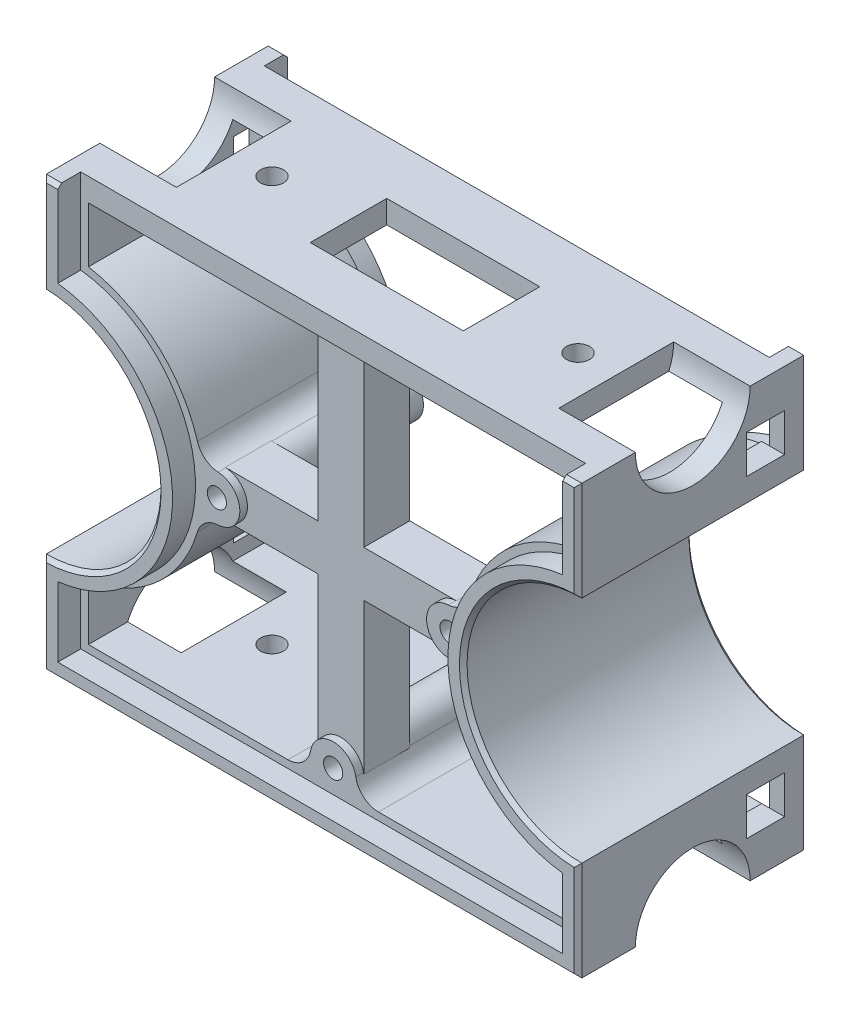
from build123d import *

# Parameters (mm, degrees)
SKETCH1_W                   = 70
SKETCH1_H                   = 30
BOSS_EXTRUDE1_DEPTH         = 56
CUT_EXTRUDE1_DEPTH          = 73.532751223
CUT_EXTRUDE2_DEPTH          = 68.720011813
CUT_EXTRUDE2_DEPTH_BACK     = 5
SKETCH3_R                   = 1.5
SKETCH4_R                   = 7.5
CUT_EXTRUDE5_DEPTH          = 10
SKETCH6_R                   = 15
CUT_EXTRUDE7_DEPTH          = 73.532751223
SKETCH7_W                   = 20
SKETCH7_H                   = 10
CUT_EXTRUDE8_DEPTH          = 10
CUT_EXTRUDE10_START         = -10
SKETCH8_R                   = 1.5
CUT_EXTRUDE10_DEPTH         = 10
CUT_EXTRUDE11_DEPTH         = 3
BOSS_EXTRUDE2_START         = -10
BOSS_EXTRUDE2_DEPTH         = 6
CHAMFER1_SIZE               = 0.5
CHAMFER2_SIZE               = 0.5
SKETCH10_W                  = 66
SKETCH10_H                  = 2
CUT_EXTRUDE13_DEPTH         = 3
CUT_EXTRUDE14_START         = -3
SKETCH12_W                  = 5
SKETCH12_H                  = 5
CUT_EXTRUDE14_DEPTH         = 3
BOSS_EXTRUDE3_START         = -24
BOSS_EXTRUDE3_DEPTH         = 24
TAP_DRILL_FOR_M3X0_5_TAP1_D = 2.5
FILLET1_R                   = 3


with BuildPart() as part:
    # Sketch1 → Boss-Extrude1 (new body)
    with BuildSketch(Plane(origin=(0, 0, 0), x_dir=(1, 0, 0), z_dir=(0, 1, 0))):
        Rectangle(SKETCH1_W, SKETCH1_H)
    extrude(amount=BOSS_EXTRUDE1_DEPTH)

    # Sketch2 → Cut-Extrude1 (cut, through all)
    with BuildSketch(Plane(origin=(0, 0, -15), x_dir=(-1, 0, 0), z_dir=(0, 0, -1))):
        with BuildLine():
            Line((32, 53), (-32, 53))
            Line((-32, 53), (-32, 45.748239349))
            ThreePointArc((-32, 45.748239349), (-17, 28), (-32, 10.251760651))
            Line((-32, 10.251760651), (-32, 3))
            Line((-32, 3), (32, 3))
            Line((32, 3), (32, 10.251760651))
            ThreePointArc((32, 10.251760651), (17, 28), (32, 45.748239349))
            Line((32, 45.748239349), (32, 53))
        make_face()
    extrude(amount=-CUT_EXTRUDE1_DEPTH, mode=Mode.SUBTRACT)

    # Sketch3 → Cut-Extrude2 (cut, two sides: drawn at the far end of the back side and taken through both)
    with BuildSketch(Plane.XZ.offset(-CUT_EXTRUDE2_DEPTH_BACK)):
        with Locations(Location((20, 0, 0), (0, 0, 90))):
            Circle(SKETCH3_R)
        with Locations(Location((-20, 0, 0), (0, 0, 90))):
            Circle(SKETCH3_R)
    extrude(amount=CUT_EXTRUDE2_DEPTH + CUT_EXTRUDE2_DEPTH_BACK, mode=Mode.SUBTRACT)

    # Sketch4 → Cut-Extrude5 (cut)
    with BuildSketch(Plane(origin=(35, 0, 0), x_dir=(0, 0, -1), z_dir=(1, 0, 0))):
        with Locations((0, 56)):
            Circle(SKETCH4_R)
        Circle(SKETCH4_R)
    cut_extrude5 = extrude(amount=-CUT_EXTRUDE5_DEPTH, mode=Mode.SUBTRACT)

    # Sketch6 → Cut-Extrude7 (cut, through all)
    with BuildSketch(Plane.XY.offset(15)):
        with Locations((-35, 28)):
            Circle(SKETCH6_R)
        with Locations((35, 28)):
            Circle(SKETCH6_R)
    extrude(amount=-CUT_EXTRUDE7_DEPTH, mode=Mode.SUBTRACT)

    # Sketch7 → Cut-Extrude8 (cut)
    with BuildSketch(Plane(origin=(0, 56, 0), x_dir=(1, 0, 0), z_dir=(0, 1, 0))):
        Rectangle(SKETCH7_W, SKETCH7_H)
    extrude(amount=-CUT_EXTRUDE8_DEPTH, mode=Mode.SUBTRACT)

    # Sketch8 → Cut-Extrude10 (cut)
    with BuildSketch(Plane(origin=(0, 56, 0), x_dir=(1, 0, 0), z_dir=(0, 1, 0)).offset(CUT_EXTRUDE10_START)):
        with Locations(Location((20, 0, 0), (0, 0, 270))):
            Circle(SKETCH8_R)
        with Locations(Location((-20, 0, 0), (0, 0, 270))):
            Circle(SKETCH8_R)
    extrude(amount=CUT_EXTRUDE10_DEPTH, mode=Mode.SUBTRACT)

    # Sketch2<3> → Cut-Extrude11 (cut)
    with BuildSketch(Plane(origin=(0, 0, -15), x_dir=(-1, 0, 0), z_dir=(0, 0, -1))):
        with BuildLine():
            Line((-33, 54), (-33, 44.881943016))
            ThreePointArc((-33, 44.881943016), (-18, 28), (-33, 11.118056984))
            Line((-33, 11.118056984), (-33, 2))
            Line((-33, 2), (33, 2))
            Line((33, 2), (33, 11.118056984))
            ThreePointArc((33, 11.118056984), (18, 28), (33, 44.881943016))
            Line((33, 44.881943016), (33, 54))
            Line((33, 54), (-33, 54))
        make_face()
        with BuildLine():
            Line((32, 53), (-32, 53))
            Line((-32, 53), (-32, 45.748239349))
            ThreePointArc((-32, 45.748239349), (-17, 28), (-32, 10.251760651))
            Line((-32, 10.251760651), (-32, 3))
            Line((-32, 3), (32, 3))
            Line((32, 3), (32, 10.251760651))
            ThreePointArc((32, 10.251760651), (17, 28), (32, 45.748239349))
            Line((32, 45.748239349), (32, 53))
        make_face(mode=Mode.SUBTRACT)
    cut_extrude11 = extrude(amount=-CUT_EXTRUDE11_DEPTH, mode=Mode.SUBTRACT)

    # Sketch11 → Boss-Extrude2 (add)
    with BuildSketch(Plane.XY.offset(15).offset(BOSS_EXTRUDE2_START)):
        with BuildLine():
            Line((-3, 3), (3, 3))
            Line((3, 3), (3, 25))
            Line((3, 25), (17.251760651, 25))
            ThreePointArc((17.251760651, 25), (17, 28), (17.251760651, 31))
            Line((17.251760651, 31), (3, 31))
            Line((3, 31), (3, 53))
            Line((3, 53), (-3, 53))
            Line((-3, 53), (-3, 31))
            Line((-3, 31), (-17.251760651, 31))
            ThreePointArc((-17.251760651, 31), (-17, 28), (-17.251760651, 25))
            Line((-17.251760651, 25), (-3, 25))
            Line((-3, 25), (-3, 3))
        make_face()
    extrude(amount=BOSS_EXTRUDE2_DEPTH)

    # Chamfer1
    chamfer1_edges = [part.edges().sort_by_distance(p)[0] for p in [
        (0, 56, 15),
        (32, 6.625880325, 15),
        (32, 49.374119675, 15),
        (0, 53, 15),
        (-32, 49.374119675, 15),
        (-17, 28, 15),
        (-32, 6.625880325, 15),
        (0, 3, 15),
        (17, 28, 15),
        (0, 0, 15),
        (35, 49.5, 15),
        (-35, 49.5, 15),
        (-35, 6.5, 15),
        (35, 6.5, 15),
        (-20, 28, 15),
        (20, 28, 15),
    ]]
    chamfer(chamfer1_edges, length=CHAMFER1_SIZE)

    # Chamfer2
    chamfer2_edges = [part.edges().sort_by_distance(p)[0] for p in [
        (0, 0, -15),
        (0, 56, -15),
        (-35, 49.5, -15),
        (35, 49.5, -15),
        (-35, 6.5, -15),
        (35, 6.5, -15),
        (-20, 28, -15),
        (20, 28, -15),
    ]]
    chamfer(chamfer2_edges, length=CHAMFER2_SIZE)

    # Sketch10 → Cut-Extrude13 (cut)
    with BuildSketch(Plane(origin=(0, 0, -15), x_dir=(-1, 0, 0), z_dir=(0, 0, -1))):
        with Locations((0, 55)):
            Rectangle(SKETCH10_W, SKETCH10_H)
    cut_extrude13 = extrude(amount=-CUT_EXTRUDE13_DEPTH, mode=Mode.SUBTRACT)

    # Mirror2: Cut-Extrude11, Cut-Extrude13 across plane
    add(cut_extrude11.mirror(Plane.XY), mode=Mode.SUBTRACT)
    add(cut_extrude13.mirror(Plane.XY), mode=Mode.SUBTRACT)

    # Sketch12 → Cut-Extrude14 (cut)
    with BuildSketch(Plane(origin=(35, 0, 0), x_dir=(0, 0, -1), z_dir=(1, 0, 0)).offset(CUT_EXTRUDE14_START)):
        with Locations((9.5, 7.5)):
            Rectangle(SKETCH12_W, SKETCH12_H)
        with Locations((9.5, 48.5)):
            Rectangle(SKETCH12_W, SKETCH12_H)
    cut_extrude14 = extrude(amount=CUT_EXTRUDE14_DEPTH, mode=Mode.SUBTRACT)

    # Mirror3: Cut-Extrude14 across plane
    add(cut_extrude14.mirror(Plane(origin=(0, 0, 0), x_dir=(0, 0, 1), z_dir=(1, 0, 0))), mode=Mode.SUBTRACT)

    # Mirror4: Cut-Extrude5 across plane
    add(cut_extrude5.mirror(Plane(origin=(0, 0, 0), x_dir=(0, 0, 1), z_dir=(1, 0, 0))), mode=Mode.SUBTRACT)

    # Sketch13 → Boss-Extrude3 (add)
    with BuildSketch(Plane(origin=(0, 0, -12), x_dir=(-1, 0, 0), z_dir=(0, 0, -1)).offset(BOSS_EXTRUDE3_START)):
        with BuildLine():
            Line((-2.236067977, 3), (2.236067977, 3))
            ThreePointArc((2.236067977, 3), (0, 8), (-2.236067977, 3))
        make_face()
        with BuildLine():
            ThreePointArc((-17.145915815, 30.287286146), (-12.204699164, 28), (-17.145915815, 25.712713854))
            ThreePointArc((-17.145915815, 25.712713854), (-17.001640796, 28), (-17.145915815, 30.287286146))
        make_face()
        with BuildLine():
            ThreePointArc((17.145915815, 30.287286146), (17.001640796, 28), (17.145915815, 25.712713854))
            ThreePointArc((17.145915815, 25.712713854), (12.204699164, 28), (17.145915815, 30.287286146))
        make_face()
    extrude(amount=BOSS_EXTRUDE3_DEPTH)

    # Tap Drill for M3x0.5 Tap1 (through all)
    with Locations(Plane(origin=(0, 0, -12), x_dir=(-1, 0, 0), z_dir=(0, 0, -1))):
        with Locations((-15.204699164, 28), (15.204699164, 28), (0, 5)):
            Hole(TAP_DRILL_FOR_M3X0_5_TAP1_D / 2)

    # Fillet1
    # the kernel refuses this fillet: 3 mm, written as the material it adds along each edge
    with BuildSketch(Plane(origin=(-17.145915815, 25.712713854, 12.276598744), x_dir=(-0.2068511279508174, -0.9783724295305314, 0), z_dir=(0, 0, -1))) as fillet1_piece_1_section:
        with BuildLine():
            CenterArc((3.153192789, -2.990178573), FILLET1_R, 94.637488492, 70.252161629)
            ThreePointArc((0.256916116, -2.208141853), (0.340537511, -1.079395596), (0, 0))
            ThreePointArc((0, 0), (1.455319749, -0.05892856), (2.910639498, 0))
        make_face()
    fillet1_piece_1 = extrude(amount=24.276598744, mode=Mode.PRIVATE)
    fillet1_piece_1 = split(fillet1_piece_1, bisect_by=Plane(origin=(-16.806719859, 24.740087729, 12), z_dir=(0, 0, -1)), keep=Keep.TOP, mode=Mode.PRIVATE)
    add(fillet1_piece_1)
    with BuildSketch(Plane(origin=(-17.145915815, 30.287286146, 12.276598744), x_dir=(-0.2068511279508151, 0.9783724295305319, 0), z_dir=(0, 0, -1))) as fillet1_piece_2_section:
        with BuildLine():
            CenterArc((3.153192789, 2.990178573), FILLET1_R, 195.110349879, 70.252161629)
            ThreePointArc((0.256916116, 2.208141853), (0.340537511, 1.079395596), (0, 0))
            ThreePointArc((0, 0), (1.455319749, 0.05892856), (2.910639498, 0))
        make_face()
    fillet1_piece_2 = extrude(amount=24.276598744, mode=Mode.PRIVATE)
    fillet1_piece_2 = split(fillet1_piece_2, bisect_by=Plane(origin=(-16.806719859, 31.259912271, 12), z_dir=(0, 0, -1)), keep=Keep.TOP, mode=Mode.PRIVATE)
    add(fillet1_piece_2)
    with BuildSketch(Plane(origin=(-2.236067977, 3, 14.200029514), x_dir=(-1, 0, 0), z_dir=(0, 0, -1))) as fillet1_piece_3_section:
        with BuildLine():
            CenterArc((3.680011806, 3), FILLET1_R, 189.594068227, 80.405931773)
            ThreePointArc((0.721971914, 2.5), (0.646151504, 1.167647394), (0, 0))
            Line((0, 0), (3.680011806, 0))
        make_face()
    fillet1_piece_3 = extrude(amount=26.200029514, mode=Mode.PRIVATE)
    fillet1_piece_3 = split(fillet1_piece_3, bisect_by=Plane(origin=(-3.476904083, 3.561012675, 12), z_dir=(0, 0, -1)), keep=Keep.TOP, mode=Mode.PRIVATE)
    add(fillet1_piece_3)
    with BuildSketch(Plane(origin=(2.236067977, 3, 14.200029514), x_dir=(1, 0, 0), z_dir=(0, 0, -1))) as fillet1_piece_4_section:
        with BuildLine():
            CenterArc((3.680011806, -3), FILLET1_R, 90, 80.405931773)
            ThreePointArc((0.721971914, -2.5), (0.646151504, -1.167647394), (0, 0))
            Line((0, 0), (3.680011806, 0))
        make_face()
    fillet1_piece_4 = extrude(amount=26.200029514, mode=Mode.PRIVATE)
    fillet1_piece_4 = split(fillet1_piece_4, bisect_by=Plane(origin=(3.476904083, 3.561012675, 12), z_dir=(0, 0, -1)), keep=Keep.TOP, mode=Mode.PRIVATE)
    add(fillet1_piece_4)
    with BuildSketch(Plane(origin=(17.145915815, 30.287286146, 12.276598744), x_dir=(0.20685112795081617, 0.9783724295305316, 0), z_dir=(0, 0, -1))) as fillet1_piece_5_section:
        with BuildLine():
            CenterArc((3.153192789, -2.990178573), FILLET1_R, 94.637488492, 70.252161629)
            ThreePointArc((0.256916116, -2.208141853), (0.340537511, -1.079395596), (0, 0))
            ThreePointArc((0, 0), (1.455319749, -0.05892856), (2.910639498, 0))
        make_face()
    fillet1_piece_5 = extrude(amount=24.276598744, mode=Mode.PRIVATE)
    fillet1_piece_5 = split(fillet1_piece_5, bisect_by=Plane(origin=(16.806719859, 31.259912271, 12), z_dir=(0, 0, -1)), keep=Keep.TOP, mode=Mode.PRIVATE)
    add(fillet1_piece_5)
    with BuildSketch(Plane(origin=(17.145915815, 25.712713854, 12.276598744), x_dir=(0.20685112795081684, -0.9783724295305316, 0), z_dir=(0, 0, -1))) as fillet1_piece_6_section:
        with BuildLine():
            CenterArc((3.153192789, 2.990178573), FILLET1_R, 195.110349879, 70.252161629)
            ThreePointArc((0.256916116, 2.208141853), (0.340537511, 1.079395596), (0, 0))
            ThreePointArc((0, 0), (1.455319749, 0.05892856), (2.910639498, 0))
        make_face()
    fillet1_piece_6 = extrude(amount=24.276598744, mode=Mode.PRIVATE)
    fillet1_piece_6 = split(fillet1_piece_6, bisect_by=Plane(origin=(16.806719859, 24.740087729, 12), z_dir=(0, 0, -1)), keep=Keep.TOP, mode=Mode.PRIVATE)
    add(fillet1_piece_6)


solid = part.part
